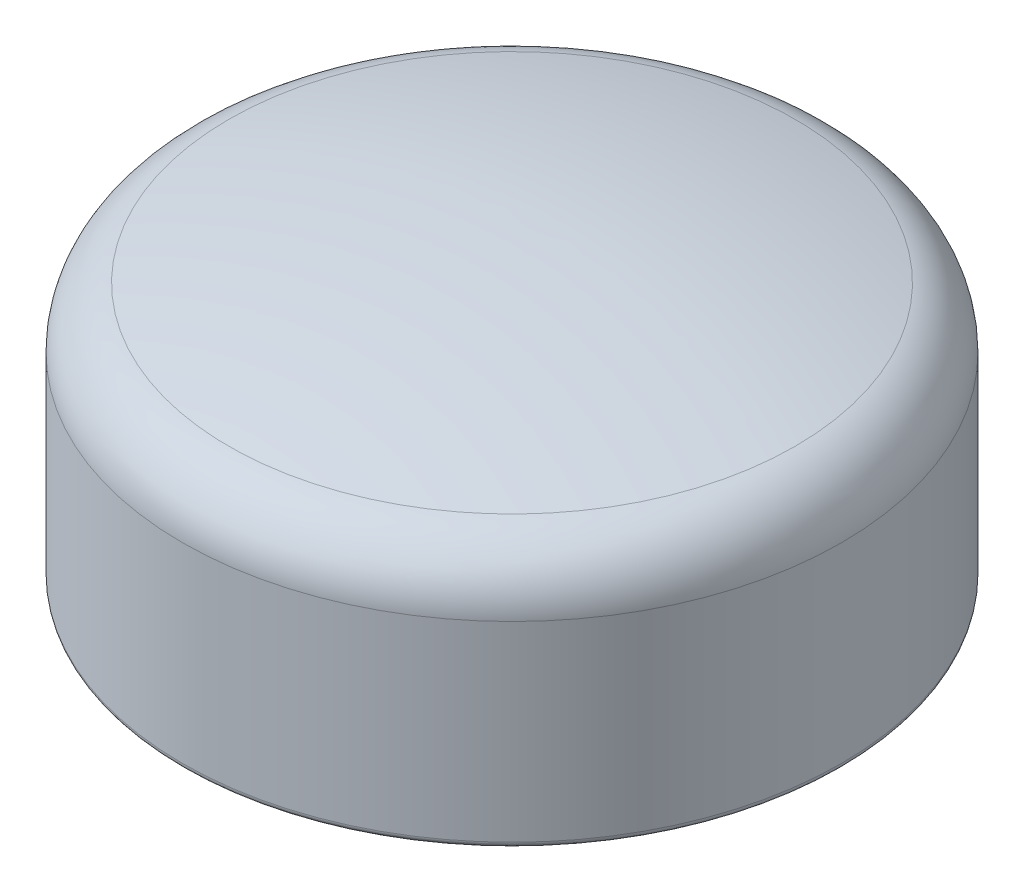
from build123d import *

# Parameters (mm, degrees)
FILLET1_R = 0.25


with BuildPart() as part:
    # Sketch1 → Revolve1 (revolve)
    with BuildSketch(Plane.XY):
        with BuildLine():
            Line((13.5, 8.080985965), (13.5, 0))
            Line((13.5, 0), (12.5, 0))
            Line((12.5, 0), (12.5, 8.080985965))
            ThreePointArc((12.5, 8.080985965), (12.177697445, 9.030458674), (11.343995274, 9.587520655))
            ThreePointArc((11.343995274, 9.587520655), (5.720941081, 10.706015676), (0, 11.080985965))
            Line((0, 11.080985965), (0, 12.080985965))
            ThreePointArc((0, 12.080985965), (5.851467273, 11.697460538), (11.60281432, 10.553446481))
            ThreePointArc((11.60281432, 10.553446481), (12.971050786, 9.639220103), (13.5, 8.080985965))
        make_face()
    revolve(axis=Axis((0, -281.832551031, 0), (0, 1, 0)))

    # Fillet1
    fillet1_edges = [part.edges().sort_by_distance(p)[0] for p in [
        (-12.5, 0, 0),
        (-13.5, 0, 0),
    ]]
    fillet(fillet1_edges, radius=FILLET1_R)


solid = part.part
